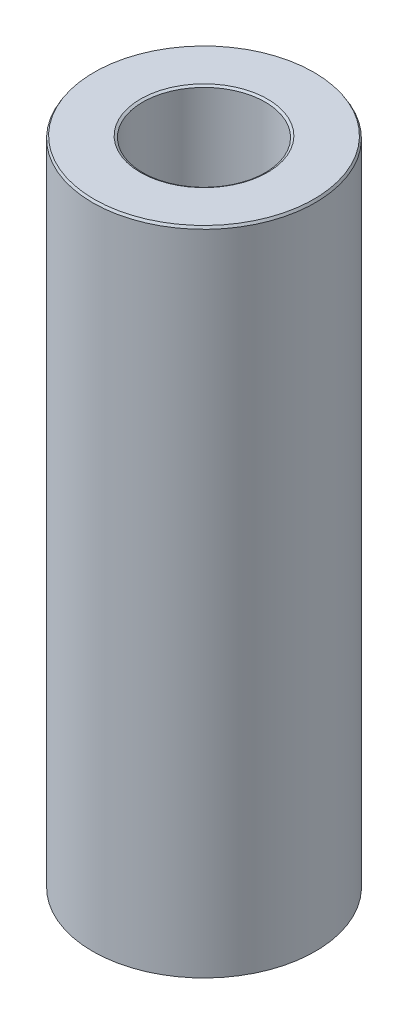
from build123d import *
from OCP.BRepFilletAPI import BRepFilletAPI_MakeChamfer

# Parameters (mm, degrees)
SKETCH1_R           = 30
BOSS_EXTRUDE1_DEPTH = 175.694921431
SKETCH2_R           = 16.498407925
CUT_EXTRUDE1_DEPTH  = 181.744862767
CHAMFER1_SIZE       = 0.631383988
CHAMFER1_SIZE2      = 0.384070202


with BuildPart() as part:
    # Sketch1 → Boss-Extrude1 (new body)
    with BuildSketch(Plane(origin=(0, 0, 0), x_dir=(1, 0, 0), z_dir=(0, 1, 0))):
        Circle(SKETCH1_R)
    extrude(amount=BOSS_EXTRUDE1_DEPTH)

    # Sketch2 → Cut-Extrude1 (cut, through all)
    with BuildSketch(Plane(origin=(0, 0, 0), x_dir=(1, 0, 0), z_dir=(0, 1, 0))):
        Circle(SKETCH2_R)
    extrude(amount=CUT_EXTRUDE1_DEPTH, mode=Mode.SUBTRACT)

    # Chamfer1: one chamfer whose edges measure the first distance from different faces: ONE call of the kernel's chamfer builder (chamfer() names one face for all edges)
    chamfer1_edges_1 = [part.edges().sort_by_distance(p)[0] for p in [
        (-16.498407925, 175.694921431, 0),
    ]]
    chamfer1_side_1 = [part.faces().sort_by_distance(p)[0] for p in [
        (-29.151471863, 175.694921431, 0),
    ]]
    chamfer1_edges_2 = [part.edges().sort_by_distance(p)[0] for p in [
        (-16.498407925, 0, 0),
    ]]
    chamfer1_side_2 = [part.faces().sort_by_distance(p)[0] for p in [
        (-16.498407925, 87.847460716, 0),
    ]]
    chamfer1_edges_3 = [part.edges().sort_by_distance(p)[0] for p in [
        (-30, 0, 0),
    ]]
    chamfer1_side_3 = [part.faces().sort_by_distance(p)[0] for p in [
        (-29.151471863, 0, 0),
    ]]
    chamfer1_edges_4 = [part.edges().sort_by_distance(p)[0] for p in [
        (-30, 175.694921431, 0),
    ]]
    chamfer1_side_4 = [part.faces().sort_by_distance(p)[0] for p in [
        (-30, 87.847460716, 0),
    ]]
    chamfer1 = BRepFilletAPI_MakeChamfer(part.part.solid().wrapped)
    for e in chamfer1_edges_1:
        chamfer1.Add(CHAMFER1_SIZE, CHAMFER1_SIZE2, e.wrapped, chamfer1_side_1[0].wrapped)  # the first distance lies on this face
    for e in chamfer1_edges_2:
        chamfer1.Add(CHAMFER1_SIZE, CHAMFER1_SIZE2, e.wrapped, chamfer1_side_2[0].wrapped)  # the first distance lies on this face
    for e in chamfer1_edges_3:
        chamfer1.Add(CHAMFER1_SIZE, CHAMFER1_SIZE2, e.wrapped, chamfer1_side_3[0].wrapped)  # the first distance lies on this face
    for e in chamfer1_edges_4:
        chamfer1.Add(CHAMFER1_SIZE, CHAMFER1_SIZE2, e.wrapped, chamfer1_side_4[0].wrapped)  # the first distance lies on this face
    add(Compound.cast(chamfer1.Shape()), mode=Mode.REPLACE)


solid = part.part
